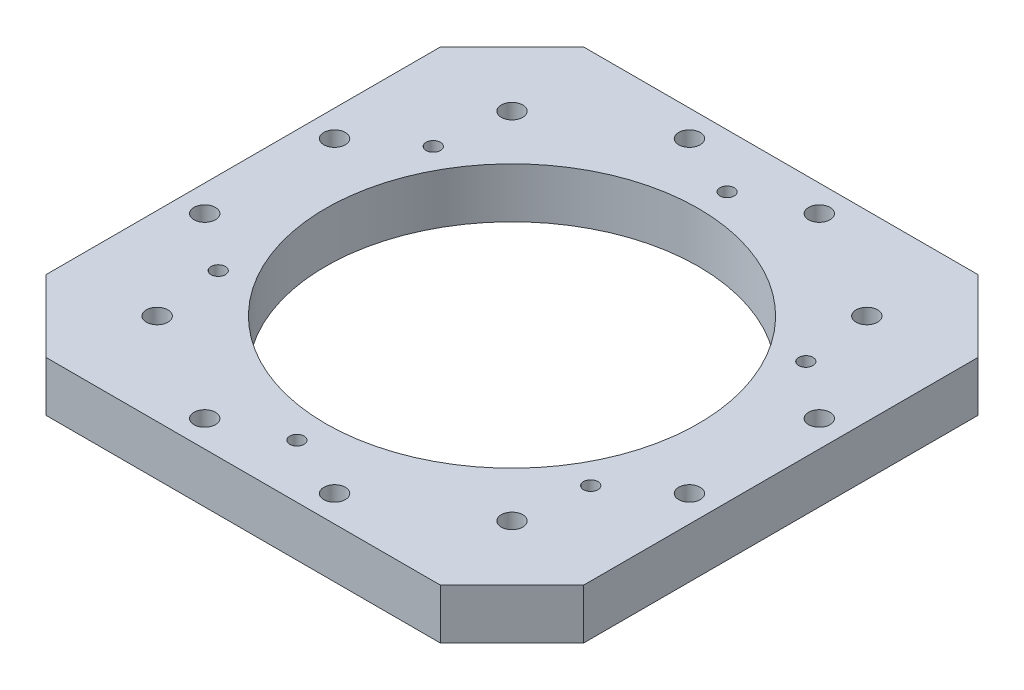
from build123d import *

# Parameters (mm, degrees)
SKETCH1_W           = 75
SKETCH1_H           = 75
SKETCH1_R           = 26
SKETCH1_R_2         = 1
SKETCH1_R_3         = 1.5
BOSS_EXTRUDE1_DEPTH = 7
CHAMFER1_SIZE       = 10


with BuildPart() as part:
    # Sketch1 → Boss-Extrude1 (new body)
    with BuildSketch(Plane(origin=(0, 0, 0), x_dir=(1, 0, 0), z_dir=(0, 1, 0))):
        Rectangle(SKETCH1_W, SKETCH1_H)
        Circle(SKETCH1_R, mode=Mode.SUBTRACT)
        with Locations((0, 30)):
            Circle(SKETCH1_R_2, mode=Mode.SUBTRACT)
        with Locations((25.980762114, 15)):
            Circle(SKETCH1_R_2, mode=Mode.SUBTRACT)
        with Locations((25.980762114, -15)):
            Circle(SKETCH1_R_2, mode=Mode.SUBTRACT)
        with Locations((0, -30)):
            Circle(SKETCH1_R_2, mode=Mode.SUBTRACT)
        with Locations((-25.980762114, -15)):
            Circle(SKETCH1_R_2, mode=Mode.SUBTRACT)
        with Locations((-25.980762114, 15)):
            Circle(SKETCH1_R_2, mode=Mode.SUBTRACT)
        with Locations((-33.80740392, -9.058666579)):
            Circle(SKETCH1_R_3, mode=Mode.SUBTRACT)
        with Locations((-33.80740392, 9.058666579)):
            Circle(SKETCH1_R_3, mode=Mode.SUBTRACT)
        with Locations((-24.748737342, 24.748737342)):
            Circle(SKETCH1_R_3, mode=Mode.SUBTRACT)
        with Locations((-9.058666579, 33.80740392)):
            Circle(SKETCH1_R_3, mode=Mode.SUBTRACT)
        with Locations((9.058666579, 33.80740392)):
            Circle(SKETCH1_R_3, mode=Mode.SUBTRACT)
        with Locations((24.748737342, 24.748737342)):
            Circle(SKETCH1_R_3, mode=Mode.SUBTRACT)
        with Locations((33.80740392, 9.058666579)):
            Circle(SKETCH1_R_3, mode=Mode.SUBTRACT)
        with Locations((33.80740392, -9.058666579)):
            Circle(SKETCH1_R_3, mode=Mode.SUBTRACT)
        with Locations((24.748737342, -24.748737342)):
            Circle(SKETCH1_R_3, mode=Mode.SUBTRACT)
        with Locations((9.058666579, -33.80740392)):
            Circle(SKETCH1_R_3, mode=Mode.SUBTRACT)
        with Locations((-9.058666579, -33.80740392)):
            Circle(SKETCH1_R_3, mode=Mode.SUBTRACT)
        with Locations((-24.748737342, -24.748737342)):
            Circle(SKETCH1_R_3, mode=Mode.SUBTRACT)
    extrude(amount=BOSS_EXTRUDE1_DEPTH)

    # Chamfer1
    chamfer1_edges = [part.edges().sort_by_distance(p)[0] for p in [
        (-37.5, 3.5, 37.5),
        (37.5, 3.5, 37.5),
        (37.5, 3.5, -37.5),
        (-37.5, 3.5, -37.5),
    ]]
    chamfer(chamfer1_edges, length=CHAMFER1_SIZE)


solid = part.part
